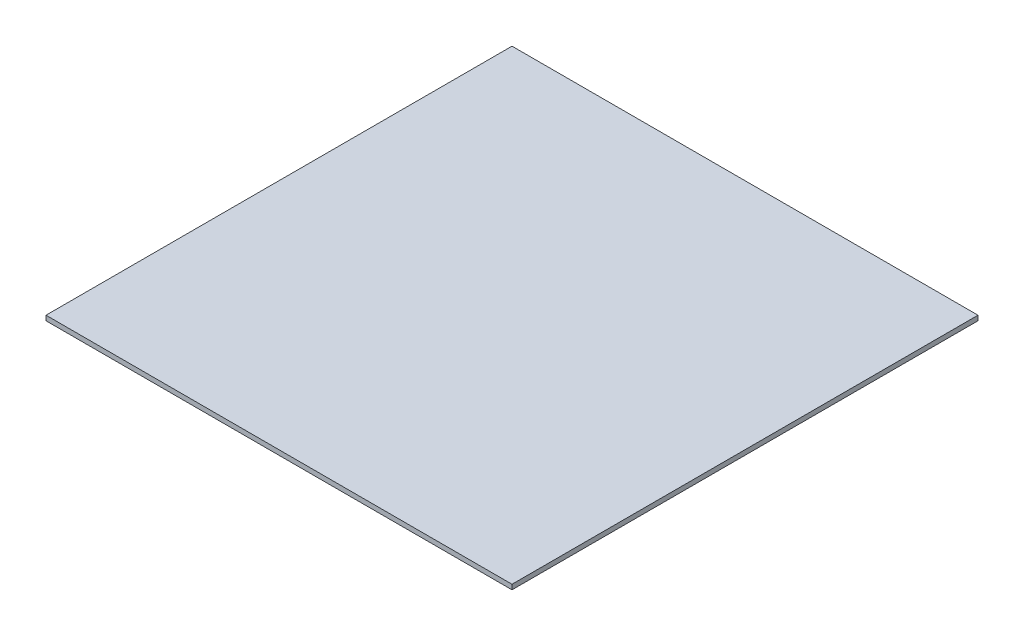
from build123d import *

# Parameters (mm, degrees)
SKETCH1_W           = 609.6
SKETCH1_H           = 609.6
BOSS_EXTRUDE1_DEPTH = 3.175


with BuildPart() as part:
    # Sketch1 → Boss-Extrude1 (new, symmetric)
    with BuildSketch(Plane(origin=(0, 0, 0), x_dir=(1, 0, 0), z_dir=(0, 1, 0))):
        Rectangle(SKETCH1_W, SKETCH1_H)
    extrude(amount=BOSS_EXTRUDE1_DEPTH, both=True)


solid = part.part
